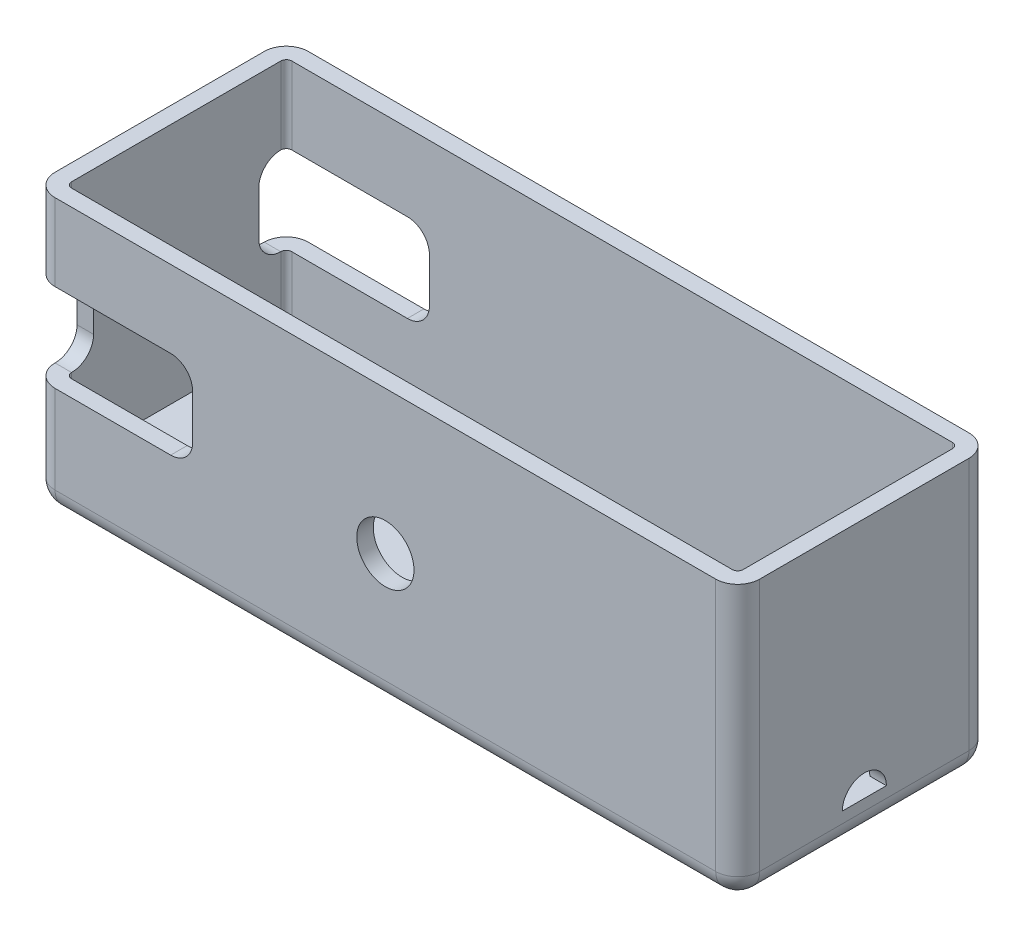
from build123d import *

# Parameters (mm, degrees)
SKETCH1_W               = 64
SKETCH1_H               = 23
SKETCH1_W_2             = 61
SKETCH1_H_2             = 20
BOSS_EXTRUDE1_DEPTH     = 3
SKETCH1_3_W             = 64
SKETCH1_3_H             = 23
SKETCH1_3_W_2           = 61
SKETCH1_3_H_2           = 20
BOSS_EXTRUDE2_DEPTH     = 22
FILLET1_R               = 2
FILLET2_R               = 0.5
CUT_EXTRUDE1_DEPTH      = 1.5
SKETCH3_R               = 1.1
CUT_EXTRUDE2_DEPTH      = 41.5
SKETCH4_W               = 10.5
SKETCH4_H               = 8
CUT_EXTRUDE3_DEPTH      = 46.133136386
SKETCH5_W               = 4
SKETCH5_H               = 8
CUT_EXTRUDE4_DEPTH      = 14.5
FILLET3_R               = 2
SKETCH6_R               = 3
CUT_EXTRUDE5_DEPTH      = 1.5
BOSS_EXTRUDE4_START     = -2
BOSS_EXTRUDE4_DEPTH     = 3
FILLET4_R               = 0.5
FILLET5_R               = 0.5
CUT_EXTRUDE6_DEPTH      = 47.733285782
CUT_EXTRUDE6_DEPTH_BACK = 1.5
SKETCH10_R              = 2.6


with BuildPart() as part:
    # Sketch1 → Boss-Extrude1 (new body)
    # profile 1 of 2: a face of its own
    with BuildSketch(Plane(origin=(0, 0, 0), x_dir=(1, 0, 0), z_dir=(0, 1, 0))):
        Rectangle(SKETCH1_W, SKETCH1_H)
        Rectangle(SKETCH1_W_2, SKETCH1_H_2, mode=Mode.SUBTRACT)
    # profile 2 of 2: a face of its own
    with BuildSketch(Plane(origin=(0, 0, 0), x_dir=(1, 0, 0), z_dir=(0, 1, 0))):
        Rectangle(SKETCH1_W_2, SKETCH1_H_2)
    extrude(amount=-BOSS_EXTRUDE1_DEPTH)

    # Sketch1<3> → Boss-Extrude2 (add)
    with BuildSketch(Plane(origin=(0, 0, 0), x_dir=(1, 0, 0), z_dir=(0, 1, 0))):
        Rectangle(SKETCH1_3_W, SKETCH1_3_H)
        Rectangle(SKETCH1_3_W_2, SKETCH1_3_H_2, mode=Mode.SUBTRACT)
    extrude(amount=BOSS_EXTRUDE2_DEPTH)

    # Fillet1
    fillet1_edges = [part.edges().sort_by_distance(p)[0] for p in [
        (0, -3, 11.5),
        (32, -3, 0),
        (0, -3, -11.5),
        (-32, -3, 0),
        (-32, 9.5, -11.5),
        (32, 9.5, -11.5),
        (32, 9.5, 11.5),
        (-32, 9.5, 11.5),
    ]]
    fillet(fillet1_edges, radius=FILLET1_R)

    # Fillet2
    fillet2_edges = [part.edges().sort_by_distance(p)[0] for p in [
        (-30.5, 11, 10),
        (30.5, 11, 10),
        (30.5, 11, -10),
        (-30.5, 11, -10),
    ]]
    fillet(fillet2_edges, radius=FILLET2_R)

    # Sketch2 → Cut-Extrude1 (cut)
    with BuildSketch(Plane(origin=(32, 0, 0), x_dir=(0, 0, -1), z_dir=(1, 0, 0))):
        with BuildLine():
            ThreePointArc((-2, 0), (0, 2), (2, 0))
            Line((2, 0), (-2, 0))
        make_face()
    extrude(amount=-CUT_EXTRUDE1_DEPTH, mode=Mode.SUBTRACT)

    # Sketch3 → Cut-Extrude2 (cut, through all)
    with BuildSketch(Plane(origin=(0, 0, 0), x_dir=(1, 0, 0), z_dir=(0, 1, 0))):
        with Locations(Location((19.4, 0, 0), (0, 0, 270))):
            Circle(SKETCH3_R)
        with Locations(Location((-4.6, 0, 0), (0, 0, 270))):
            Circle(SKETCH3_R)
    extrude(amount=-CUT_EXTRUDE2_DEPTH, mode=Mode.SUBTRACT)

    # Sketch4 → Cut-Extrude3 (cut, through all)
    with BuildSketch(Plane.XY.offset(11.5)):
        with Locations((-22.75, 11)):
            Rectangle(SKETCH4_W, SKETCH4_H)
    extrude(amount=-CUT_EXTRUDE3_DEPTH, mode=Mode.SUBTRACT)

    # Sketch5 → Cut-Extrude4 (cut)
    with BuildSketch(Plane.ZY.offset(32)):
        with Locations((-9.5, 11)):
            Rectangle(SKETCH5_W, SKETCH5_H)
        with Locations((9.5, 11)):
            Rectangle(SKETCH5_W, SKETCH5_H)
    extrude(amount=-CUT_EXTRUDE4_DEPTH, mode=Mode.SUBTRACT)

    # Fillet3
    fillet3_edges = [part.edges().sort_by_distance(p)[0] for p in [
        (-17.5, 7, -10.75),
        (-17.5, 15, -10.75),
        (-17.5, 7, 10.75),
        (-17.5, 15, 10.75),
        (-31.25, 7, -7.5),
        (-31.25, 15, -7.5),
        (-31.25, 15, 7.5),
        (-31.25, 7, 7.5),
    ]]
    fillet(fillet3_edges, radius=FILLET3_R)

    # Sketch6 → Cut-Extrude5 (cut)
    with BuildSketch(Plane.XZ.offset(3)):
        with Locations(Location((-4.6, 0, 0), (0, 0, 270))):
            Circle(SKETCH6_R)
        with Locations(Location((19.4, 0, 0), (0, 0, 270))):
            Circle(SKETCH6_R)
    extrude(amount=-CUT_EXTRUDE5_DEPTH, mode=Mode.SUBTRACT)

    # Sketch9 → Boss-Extrude4 (add)
    with BuildSketch(Plane.XZ.offset(3).offset(BOSS_EXTRUDE4_START)):
        with BuildLine():
            Line((-15, -11.5), (-16.5, -11.5))
            Line((-16.5, -11.5), (-16.5, -12))
            ThreePointArc((-16.5, -12), (-15.767766953, -13.767766953), (-14, -14.5))
            Line((-14, -14.5), (14, -14.5))
            ThreePointArc((14, -14.5), (15.767766953, -13.767766953), (16.5, -12))
            Line((16.5, -12), (16.5, -11.5))
            Line((16.5, -11.5), (15, -11.5))
            Line((15, -11.5), (15, -12))
            ThreePointArc((15, -12), (14.707106781, -12.707106781), (14, -13))
            Line((14, -13), (-14, -13))
            ThreePointArc((-14, -13), (-14.707106781, -12.707106781), (-15, -12))
            Line((-15, -12), (-15, -11.5))
        make_face()
    extrude(amount=-BOSS_EXTRUDE4_DEPTH)

    # Fillet4
    fillet4_edges = [part.edges().sort_by_distance(p)[0] for p in [
        (-15.767766953, -1, -13.767766953),
        (-16.5, 2, -11.75),
        (-15, -1, -11.75),
        (-14.707106781, 2, -12.707106781),
        (0, -1, -13),
        (14.707106781, -1, -12.707106781),
        (15, 2, -11.75),
        (16.5, -1, -11.75),
        (15.767766953, 2, -13.767766953),
        (0, 2, -14.5),
        (-15.767766953, 2, -13.767766953),
        (-15, 2, -11.75),
        (0, 2, -13),
        (14.707106781, 2, -12.707106781),
        (16.5, 2, -11.75),
        (0, -1, -14.5),
        (15.767766953, -1, -13.767766953),
        (15, -1, -11.75),
        (-14.707106781, -1, -12.707106781),
        (-16.5, -1, -11.75),
    ]]
    fillet(fillet4_edges, radius=FILLET4_R)

    # Fillet5
    fillet5_edges = [part.edges().sort_by_distance(p)[0] for p in [
        (16.353553391, 1.853553391, -11.5),
        (15.75, 2, -11.5),
        (15.146446609, 1.853553391, -11.5),
        (15, 0.5, -11.5),
        (15.146446609, -0.853553391, -11.5),
        (-15.75, -1, -11.5),
        (15.75, -1, -11.5),
        (16.353553391, -0.853553391, -11.5),
        (-15.146446609, 1.853553391, -11.5),
        (-15.75, 2, -11.5),
        (-16.353553391, 1.853553391, -11.5),
        (-16.5, 0.5, -11.5),
        (-16.353553391, -0.853553391, -11.5),
        (-15.146446609, -0.853553391, -11.5),
        (16.5, 0.5, -11.5),
        (-15, 0.5, -11.5),
    ]]
    fillet(fillet5_edges, radius=FILLET5_R - 0.0001)  # a hair under: the kernel refuses the full size

    # Sketch10 → Cut-Extrude6 (cut, two sides: drawn at the far end of the back side and taken through both)
    with BuildSketch(Plane.XY.offset(11.5).offset(-CUT_EXTRUDE6_DEPTH_BACK)):
        with Locations(Location((0, 9, 0), (0, 0, 180))):
            Circle(SKETCH10_R)
    extrude(amount=CUT_EXTRUDE6_DEPTH + CUT_EXTRUDE6_DEPTH_BACK, mode=Mode.SUBTRACT)


solid = part.part
